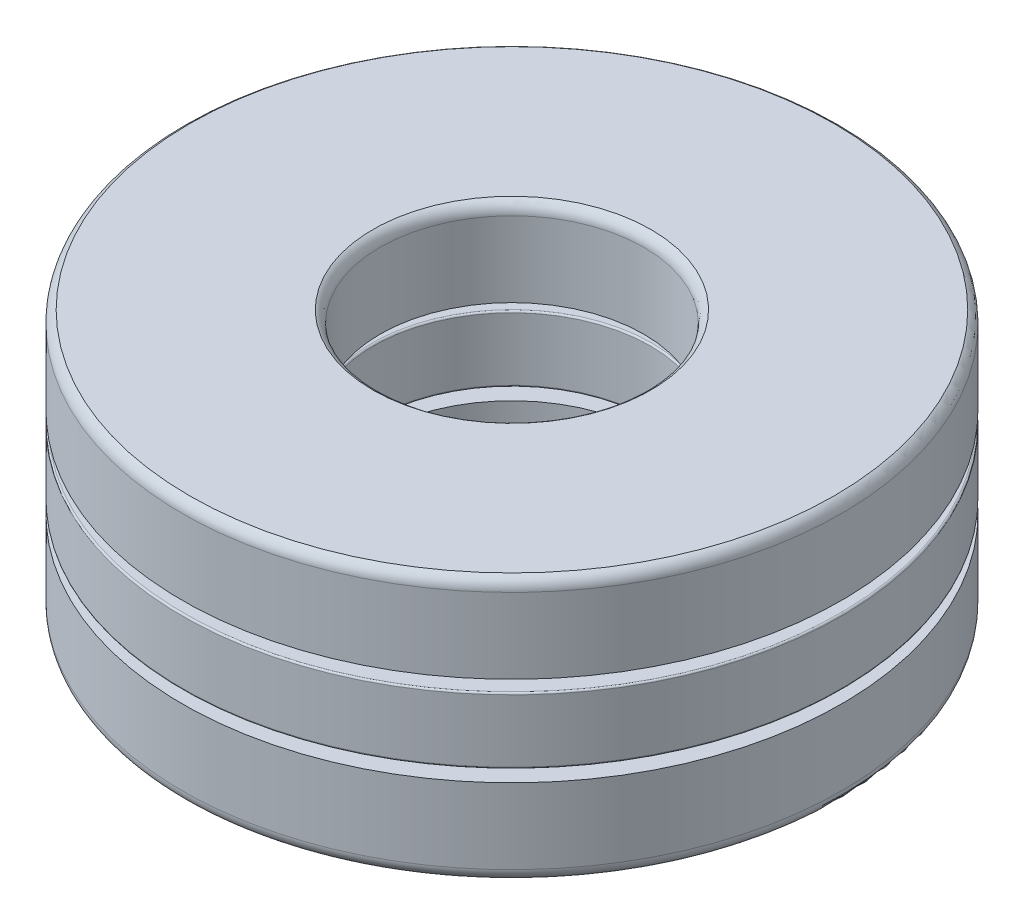
from build123d import *

# Parameters (mm, degrees)
CIRPATTERN1_COUNT = 7
CIRPATTERN2_COUNT = 7


# Read off the part's stored shape, not the designer's step: Cut-Revolve1
with BuildPart() as part:
    # Sketch3 → Revolve1 (revolve)
    with BuildSketch(Plane(origin=(0, 0, 0), x_dir=(0, 0, -1), z_dir=(1, 0, 0))):
        with BuildLine():
            Line((5, 0.68), (4.398679121, 0.68))
            ThreePointArc((4.398679121, 0.68), (3.55, 1.0875), (2.701320879, 0.68))
            Line((2.701320879, 0.68), (2, 0.68))
            Line((2, 0.68), (2, 1.821394289))
            ThreePointArc((2, 1.821394289), (2.029706136, 1.926275174), (2.11, 2))
            Line((2.11, 2), (4.89, 2))
            ThreePointArc((4.89, 2), (4.970293864, 1.926275174), (5, 1.821394289))
            Line((5, 1.821394289), (5, 0.68))
        make_face()
        with BuildLine():
            Line((2.701320879, -0.68), (2.1, -0.68))
            Line((2.1, -0.68), (2.1, -1.821394289))
            ThreePointArc((2.1, -1.821394289), (2.129706136, -1.926275174), (2.21, -2))
            Line((2.21, -2), (4.89, -2))
            ThreePointArc((4.89, -2), (4.970293864, -1.926275174), (5, -1.821394289))
            Line((5, -1.821394289), (5, -0.68))
            Line((5, -0.68), (4.398679121, -0.68))
            ThreePointArc((4.398679121, -0.68), (3.55, -1.0875), (2.701320879, -0.68))
        make_face()
        with BuildLine():
            Line((4.975, 0.5), (2.125, 0.5))
            ThreePointArc((2.125, 0.5), (2.10732233, 0.49267767), (2.1, 0.475))
            Line((2.1, 0.475), (2.1, -0.475))
            ThreePointArc((2.1, -0.475), (2.10732233, -0.49267767), (2.125, -0.5))
            Line((2.125, -0.5), (4.975, -0.5))
            ThreePointArc((4.975, -0.5), (4.99267767, -0.49267767), (5, -0.475))
            Line((5, -0.475), (5, 0.475))
            ThreePointArc((5, 0.475), (4.99267767, 0.49267767), (4.975, 0.5))
        make_face()
    revolve(axis=Axis((0, -2, 0), (0, 1, 0)))

    # Cut-Revolve1 outline → Cut-Revolve1 (revolve, cut)
    with BuildSketch(Plane.XY.offset(-3.55)):
        with BuildLine():
            Line((1.026585853, 0.500000001), (0, 0.500000001))
            Line((0, 0.500000001), (0, -0.500000001))
            Line((0, -0.500000001), (1.026585853, -0.500000001))
            ThreePointArc((1.026585853, -0.500000001), (1.141875, 0), (1.026585853, 0.500000001))
        make_face()
    cut_revolve1 = revolve(axis=Axis((0, 0, -3.55), (0, 1, 0)), mode=Mode.SUBTRACT)

    # CirPattern2: Cut-Revolve1 ×7 about axis
    cirpattern2_axis = Axis((0, 0, 0), (0, 1, 0))
    for i in range(1, CIRPATTERN2_COUNT):
        add(cut_revolve1.rotate(cirpattern2_axis, i * 360 / CIRPATTERN2_COUNT), mode=Mode.SUBTRACT)


with BuildPart() as body_2:
    # Sketch4 → Revolve2 (revolve)
    with BuildSketch(Plane(origin=(0, 0, 0), x_dir=(0, 0, -1), z_dir=(1, 0, 0))):
        with BuildLine():
            Line((3.55, -1.0875), (3.55, 1.0875))
            ThreePointArc((3.55, 1.0875), (2.4625, 0), (3.55, -1.0875))
        make_face()
    revolve(axis=Axis((0, 2, -3.55), (0, -1, 0)))


with BuildPart() as cirpattern1_1:
    # CirPattern1: pattern copy
    add(body_2.part.rotate(Axis((0, 0, 0), (0, 1, 0)), 1 * 360 / CIRPATTERN1_COUNT))


with BuildPart() as cirpattern1_2:
    # CirPattern1: pattern copy
    add(body_2.part.rotate(Axis((0, 0, 0), (0, 1, 0)), 2 * 360 / CIRPATTERN1_COUNT))


with BuildPart() as cirpattern1_3:
    # CirPattern1: pattern copy
    add(body_2.part.rotate(Axis((0, 0, 0), (0, 1, 0)), 3 * 360 / CIRPATTERN1_COUNT))


with BuildPart() as cirpattern1_4:
    # CirPattern1: pattern copy
    add(body_2.part.rotate(Axis((0, 0, 0), (0, 1, 0)), 4 * 360 / CIRPATTERN1_COUNT))


with BuildPart() as cirpattern1_5:
    # CirPattern1: pattern copy
    add(body_2.part.rotate(Axis((0, 0, 0), (0, 1, 0)), 5 * 360 / CIRPATTERN1_COUNT))


with BuildPart() as cirpattern1_6:
    # CirPattern1: pattern copy
    add(body_2.part.rotate(Axis((0, 0, 0), (0, 1, 0)), 6 * 360 / CIRPATTERN1_COUNT))


solid = Compound([part.part, body_2.part, cirpattern1_1.part, cirpattern1_2.part, cirpattern1_3.part, cirpattern1_4.part, cirpattern1_5.part, cirpattern1_6.part])
